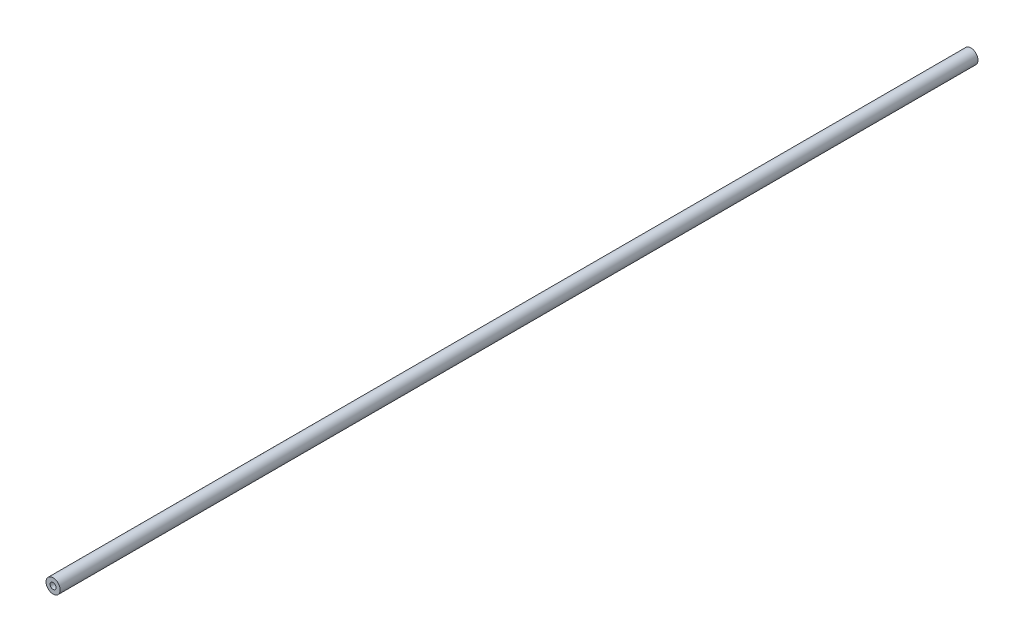
from build123d import *

# Parameters (mm, degrees)
SKETCH1_R                            = 4.7625
BOSS_EXTRUDE1_DEPTH                  = 307.975
F_10_32_TAPPED_HOLE1_D               = 4.0386
F_10_32_TAPPED_HOLE1_DEPTH           = 12.02944
F_10_32_TAPPED_HOLE1_TIP             = 1.213317848
F_10_32_TAPPED_HOLE1_ON_FACE_2_D     = 4.0386
F_10_32_TAPPED_HOLE1_ON_FACE_2_DEPTH = 12.02944
F_10_32_TAPPED_HOLE1_ON_FACE_2_TIP   = 1.213317848


with BuildPart() as part:
    # Sketch1 → Boss-Extrude1 (new, symmetric)
    with BuildSketch(Plane.XY):
        Circle(SKETCH1_R)
    extrude(amount=BOSS_EXTRUDE1_DEPTH, both=True)

    # #10-32 Tapped Hole1
    with Locations(Plane(origin=(0, 0, -307.975), x_dir=(-1, 0, 0), z_dir=(0, 0, -1))):
        with Locations((0, 0)):
            Hole(F_10_32_TAPPED_HOLE1_D / 2, depth=F_10_32_TAPPED_HOLE1_DEPTH)
            with Locations((0, 0, -(F_10_32_TAPPED_HOLE1_DEPTH + F_10_32_TAPPED_HOLE1_TIP / 2))):  # 118° drill point
                Cone(0, F_10_32_TAPPED_HOLE1_D / 2, F_10_32_TAPPED_HOLE1_TIP, mode=Mode.SUBTRACT)

    # #10-32 Tapped Hole1 on face 2
    with Locations(Plane.XY.offset(307.975)):
        with Locations((0, 0)):
            Hole(F_10_32_TAPPED_HOLE1_ON_FACE_2_D / 2, depth=F_10_32_TAPPED_HOLE1_ON_FACE_2_DEPTH)
            with Locations((0, 0, -(F_10_32_TAPPED_HOLE1_ON_FACE_2_DEPTH + F_10_32_TAPPED_HOLE1_ON_FACE_2_TIP / 2))):  # 118° drill point
                Cone(0, F_10_32_TAPPED_HOLE1_ON_FACE_2_D / 2, F_10_32_TAPPED_HOLE1_ON_FACE_2_TIP, mode=Mode.SUBTRACT)


solid = part.part
